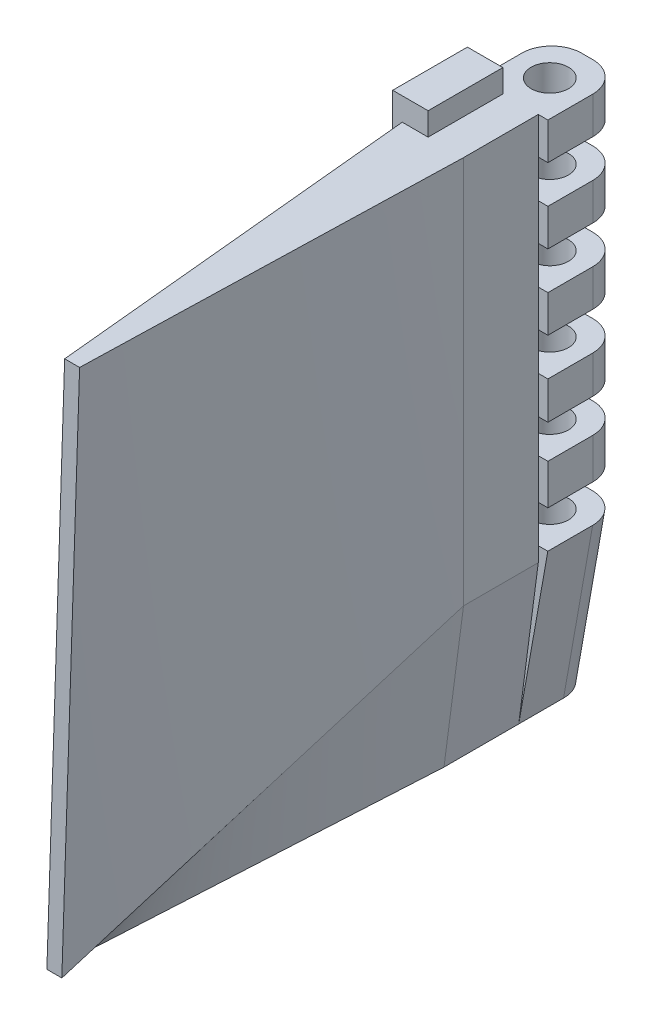
from build123d import *

# Parameters (mm, degrees)
SKETCH1_W             = 9.495809557
SKETCH1_H             = 5.4
BOSS_EXTRUDE1_DEPTH   = 10
SKETCH1_H_2           = 5.02
BOSS_EXTRUDE1_2_DEPTH = 10
SKETCH1_H_3           = 4.94
BOSS_EXTRUDE1_3_DEPTH = 10
BOSS_EXTRUDE1_4_DEPTH = 10
BOSS_EXTRUDE1_5_DEPTH = 10
BOSS_EXTRUDE2_DEPTH   = 10
BOSS_EXTRUDE3_DEPTH   = 10
FILLET1_R             = 4
SKETCH6_R             = 2.5
CUT_EXTRUDE1_DEPTH    = 55


with BuildPart() as part:
    # Sketch1 → Boss-Extrude1 (new body)
    with BuildSketch(Plane.XY):
        with Locations((9.321382843, 6.543931341)):
            Rectangle(SKETCH1_W, SKETCH1_H)
    extrude(amount=-BOSS_EXTRUDE1_DEPTH)



with BuildPart() as body_2:
    # Sketch1 → Boss-Extrude1 2 (new body)
    with BuildSketch(Plane.XY):
        with Locations((9.321382843, 16.273802043)):
            Rectangle(SKETCH1_W, SKETCH1_H_2)
    extrude(amount=-BOSS_EXTRUDE1_2_DEPTH)


with BuildPart() as body_3:
    # Sketch1 → Boss-Extrude1 3 (new body)
    with BuildSketch(Plane.XY):
        with Locations((9.321382843, 26.315620999)):
            Rectangle(SKETCH1_W, SKETCH1_H_3)
    extrude(amount=-BOSS_EXTRUDE1_3_DEPTH)


with BuildPart() as body_4:
    # Sketch1 → Boss-Extrude1 4 (new body)
    with BuildSketch(Plane.XY):
        with Locations((9.321382843, 36.315620999)):
            Rectangle(SKETCH1_W, SKETCH1_H_3)
    extrude(amount=-BOSS_EXTRUDE1_4_DEPTH)


with BuildPart() as body_5:
    # Sketch1 → Boss-Extrude1 5 (new body)
    with BuildSketch(Plane.XY):
        Polygon((4.573645694, 48.785620997), (4.573479076, 43.845621), (14.069286609, 43.845621), (14.069119991, 48.785620997), align=None)
    extrude(amount=-BOSS_EXTRUDE1_5_DEPTH)


with BuildPart() as part_1:
    add(part.part)

    add(body_2.part)  # Boss-Extrude2 merges body 2

    add(body_3.part)  # Boss-Extrude2 merges body 3

    add(body_4.part)  # Boss-Extrude2 merges body 4

    add(body_5.part)  # Boss-Extrude2 merges body 5
    # Boss-Extrude2: read off the stored shape, not the designer's step
    # Boss-Extrude2 outline → Boss-Extrude2 (add)
    with BuildSketch(Plane.XY):
        Polygon((10.164012515, -23.151739204), (12.780095601, -3.151737932), (12.780095601, 48.785620997), (8.038968881, 48.785620997), (8.038703883, 51.848260515), (3.297312166, 51.848260515), (3.297312166, -3.151737932), (5.92637416, -23.151739204), align=None)
    extrude(amount=BOSS_EXTRUDE2_DEPTH)

    # Sketch3 → Boss-Extrude3 (add)
    with BuildSketch(Plane(origin=(0, 0, 0), x_dir=(-1, 0, 0), z_dir=(0, 0, -1))):
        Polygon((-4.573478064, -1.184377448), (-14.056261499, -1.184377448), (-10.164012515, -23.151739204), (-5.92637416, -23.151739204), align=None)
    extrude(amount=BOSS_EXTRUDE3_DEPTH)

    # Fillet1
    # the kernel refuses this fillet: 4 mm, written as the material it takes off along each edge
    with BuildSketch(Plane(origin=(15.800919998, 8.662254805, -10), x_dir=(0, 0, 1), z_dir=(-0.17446584987640118, -0.9846632252841095, 0))) as fillet1_piece_1:
        with BuildLine():
            CenterArc((FILLET1_R, FILLET1_R), FILLET1_R, 180, 90)
            Line((0, FILLET1_R), (0, 0))
            Line((0, 0), (FILLET1_R, 0))
        make_face()
    extrude(amount=42.309517805, mode=Mode.SUBTRACT)
    with BuildSketch(Plane(origin=(6.54107595, -33.132828409, -10), x_dir=(0, 0, 1), z_dir=(-0.06147017908550384, 0.9981089204506671, 0))) as fillet1_piece_2:
        with BuildLine():
            CenterArc((FILLET1_R, FILLET1_R), FILLET1_R, 180, 90)
            Line((0, FILLET1_R), (0, 0))
            Line((0, 0), (FILLET1_R, 0))
        make_face()
    extrude(amount=42.008982493, mode=Mode.SUBTRACT)
    with BuildSketch(Plane(origin=(4.573982978, 58.785620992, -10), x_dir=(0, 0, 1), z_dir=(-3.372835133255536e-05, -0.9999999994311992, 0))) as fillet1_piece_3_section:
        with BuildLine():
            CenterArc((FILLET1_R, -FILLET1_R), FILLET1_R, 90, 90)
            Line((0, -FILLET1_R), (0, 0))
            Line((0, 0), (FILLET1_R, 0))
        make_face()
    fillet1_piece_3 = extrude(amount=24.94, mode=Mode.PRIVATE)
    fillet1_piece_3 = split(fillet1_piece_3, bisect_by=Plane(origin=(4.573982978, 38.785620999, -10), z_dir=(0, 1, 0)), keep=Keep.TOP, mode=Mode.PRIVATE)
    add(fillet1_piece_3, mode=Mode.SUBTRACT)
    with BuildSketch(Plane(origin=(14.069623892, 33.845621006, -10), x_dir=(0, 0, 1), z_dir=(-3.372835144025149e-05, 0.9999999994311992, 0)), Plane(origin=(14.069287621, 23.845620999, -10), x_dir=(0, 0, 1), z_dir=(0, 1, 0)), Plane(origin=(14.069287621, 13.845620999, -10), x_dir=(0, 0, 1), z_dir=(0, 1, 0))) as fillet1_piece_4:
        with BuildLine():
            CenterArc((FILLET1_R, -FILLET1_R), FILLET1_R, 90, 90)
            Line((0, -FILLET1_R), (0, 0))
            Line((0, 0), (FILLET1_R, 0))
        make_face()
    extrude(amount=24.94, mode=Mode.SUBTRACT)
    with BuildSketch(Plane(origin=(14.069287621, 3.763802043, -10), x_dir=(0, 0, 1), z_dir=(0, 1, 0))) as fillet1_piece_5:
        with BuildLine():
            CenterArc((FILLET1_R, -FILLET1_R), FILLET1_R, 90, 90)
            Line((0, -FILLET1_R), (0, 0))
            Line((0, 0), (FILLET1_R, 0))
        make_face()
    extrude(amount=25.02, mode=Mode.SUBTRACT)
    with BuildSketch(Plane(origin=(14.069287621, -6.156068659, -10), x_dir=(-1, 0, 0), z_dir=(0, 1, 0))) as fillet1_piece_6:
        with BuildLine():
            CenterArc((FILLET1_R, FILLET1_R), FILLET1_R, 180, 90)
            Line((0, FILLET1_R), (0, 0))
            Line((0, 0), (FILLET1_R, 0))
        make_face()
    extrude(amount=25.4, mode=Mode.SUBTRACT)
    with BuildSketch(Plane(origin=(4.573478064, 19.243931341, -10), x_dir=(0, 0, 1), z_dir=(0, -1, 0))) as fillet1_piece_7_section:
        with BuildLine():
            CenterArc((FILLET1_R, -FILLET1_R), FILLET1_R, 90, 90)
            Line((0, -FILLET1_R), (0, 0))
            Line((0, 0), (FILLET1_R, 0))
        make_face()
    fillet1_piece_7 = extrude(amount=25.4, mode=Mode.PRIVATE)
    fillet1_piece_7 = split(fillet1_piece_7, bisect_by=Plane(origin=(4.573478064, 13.763802043, -10), z_dir=(0, -1, 0)), keep=Keep.TOP, mode=Mode.PRIVATE)
    add(fillet1_piece_7, mode=Mode.SUBTRACT)

    # Loft2: read off the stored shape, not the designer's step
    # Loft2: loft between two sections, ruled curve by curve
    loft2_from = [
        Edge.make_bspline([(12.780095601, -3.151737932, 10), (12.780095601, 5.504488557, 10), (12.780095601, 14.160715045, 10), (12.780095601, 31.473168021, 10), (12.780095601, 40.129394509, 10), (12.780095601, 48.785620997, 10)], [0, 0, 0, 0, 0.5, 0.5, 1, 1, 1, 1], 3),
        Edge.make_bspline([(4.573645694, 48.785620997, 10), (4.573617756, 40.457287923, 10), (4.573589817, 32.128954849, 10), (4.573533941, 15.472288701, 10), (4.573506003, 7.143955626, 10), (4.573478064, -1.184377448, 10)], [0, 0, 0, 0, 0.5, 0.5, 1, 1, 1, 1], 3),
        Edge.make_bspline([(4.573478064, -1.184377448, 10), (4.798960747, -4.845604407, 10), (5.024443429, -8.506831367, 10), (5.475408794, -15.829285285, 10), (5.700891477, -19.490512245, 10), (5.92637416, -23.151739204, 10)], [0, 0, 0, 0, 0.5, 0.5, 1, 1, 1, 1], 3),
        Edge.make_bspline([(10.164012515, -23.151739204, 10), (10.600026362, -19.818405659, 10), (11.03604021, -16.485072113, 10), (11.908067905, -9.818405022, 10), (12.344081753, -6.485071477, 10), (12.780095601, -3.151737932, 10)], [0, 0, 0, 0, 0.5, 0.5, 1, 1, 1, 1], 3),
        Edge.make_line((10.164012515, -23.151739204, 10), (5.92637416, -23.151739204, 10)),
        Edge.make_line((4.573645694, 48.785620997, 10), (12.780095601, 48.785620997, 10)),
    ]
    loft2_to = [
        Edge.make_bspline([(9.030825072, -23.151739204, 60), (9.427276266, -11.162179171, 60), (9.823727461, 0.827380863, 60), (10.616629851, 24.80650093, 60), (11.013081046, 36.796060964, 60), (11.409532241, 48.785620997, 60)], [0, 0, 0, 0, 0.5, 0.5, 1, 1, 1, 1], 3),
        Edge.make_bspline([(9.409532241, 48.785620997, 60), (9.13430376, 40.462103653, 60), (8.859075279, 32.138586309, 60), (8.308618317, 15.491551622, 60), (8.033389836, 7.168034278, 60), (7.758161355, -1.155483066, 60)], [0, 0, 0, 0, 0.5, 0.5, 1, 1, 1, 1], 3),
        Edge.make_bspline([(7.758161355, -1.155483066, 60), (7.636938641, -4.821525756, 60), (7.515715927, -8.487568446, 60), (7.273270499, -15.819653825, 60), (7.152047785, -19.485696515, 60), (7.030825072, -23.151739204, 60)], [0, 0, 0, 0, 0.5, 0.5, 1, 1, 1, 1], 3),
        Edge.make_bspline([(7.378058471, -23.151739204, 60), (7.653519571, -23.151739204, 60), (7.928980671, -23.151739204, 60), (8.479902871, -23.151739204, 60), (8.755363971, -23.151739204, 60), (9.030825072, -23.151739204, 60)], [0, 0, 0, 0, 0.5, 0.5, 1, 1, 1, 1], 3),
        Edge.make_line((7.378058471, -23.151739204, 60), (7.030825072, -23.151739204, 60)),
        Edge.make_line((9.409532241, 48.785620997, 60), (11.409532241, 48.785620997, 60)),
    ]
    loft2 = Solid(Shell([*[Face.make_surface_from_curves(loft2_from[k], loft2_to[k]) for k in range(6)], Face(Wire(loft2_from)), Face(Wire(loft2_to))]))
    add(loft2)

    # Sketch6 → Cut-Extrude1 (cut)
    with BuildSketch(Plane(origin=(0, 48.785620997, 0), x_dir=(1, 0, 0), z_dir=(0, 1, 0))):
        with Locations(Location((9.321382843, 5, 0), (0, 0, 270))):
            Circle(SKETCH6_R)
    extrude(amount=-CUT_EXTRUDE1_DEPTH, mode=Mode.SUBTRACT)


solid = part_1.part
